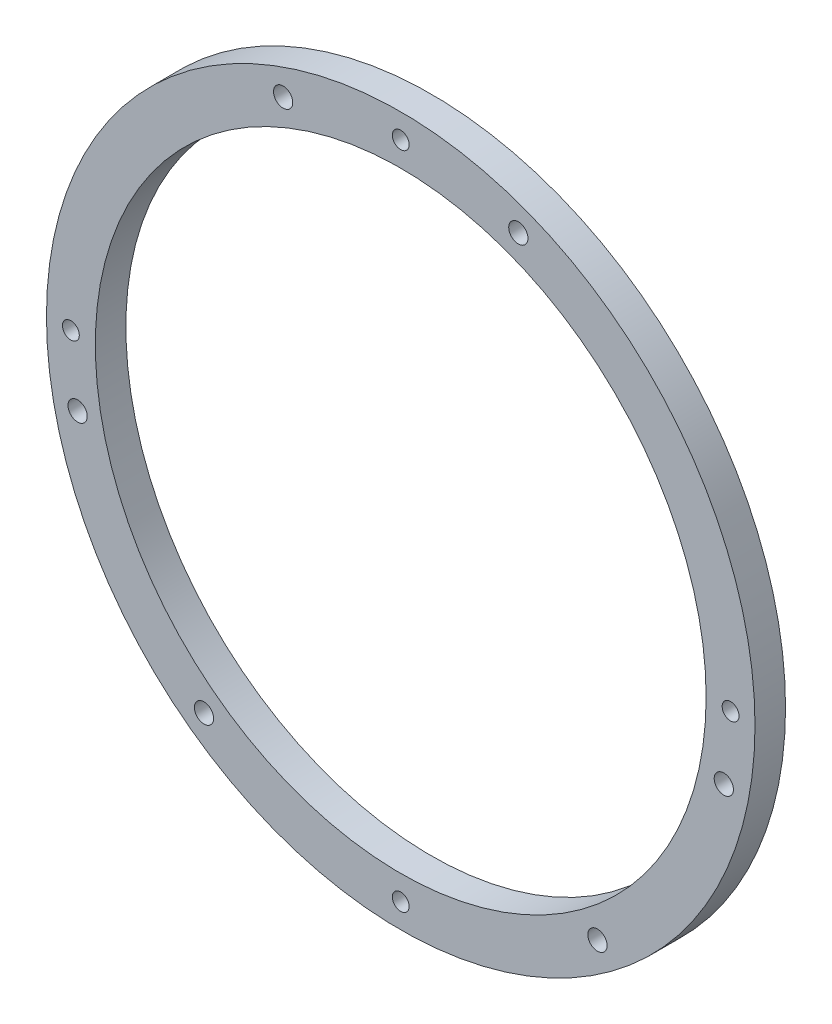
from build123d import *

# Parameters (mm, degrees)
SKETCH2_R           = 73.66
SKETCH2_R_2         = 63.5
SKETCH2_R_3         = 1.75
SKETCH2_R_4         = 2
BOSS_EXTRUDE1_DEPTH = 6.35


with BuildPart() as part:
    # Sketch2 → Boss-Extrude1 (new body)
    with BuildSketch(Plane.XY.offset(-69.215)):
        Circle(SKETCH2_R)
        Circle(SKETCH2_R_2, mode=Mode.SUBTRACT)
        with Locations((-68.58, 0)):
            Circle(SKETCH2_R_3, mode=Mode.SUBTRACT)
        with Locations((0, 68.58)):
            Circle(SKETCH2_R_3, mode=Mode.SUBTRACT)
        with Locations((68.58, 0)):
            Circle(SKETCH2_R_3, mode=Mode.SUBTRACT)
        with Locations((0, -68.58)):
            Circle(SKETCH2_R_3, mode=Mode.SUBTRACT)
        with Locations((-24.449968278, 64.073515989)):
            Circle(SKETCH2_R_4, mode=Mode.SUBTRACT)
        with Locations((24.449968278, 64.073515989)):
            Circle(SKETCH2_R_4, mode=Mode.SUBTRACT)
        with Locations((-67.176013668, -13.80578095)):
            Circle(SKETCH2_R_4, mode=Mode.SUBTRACT)
        with Locations((-40.902096909, -55.047569142)):
            Circle(SKETCH2_R_4, mode=Mode.SUBTRACT)
        with Locations((40.902096909, -55.047569142)):
            Circle(SKETCH2_R_4, mode=Mode.SUBTRACT)
        with Locations((67.176013668, -13.80578095)):
            Circle(SKETCH2_R_4, mode=Mode.SUBTRACT)
    extrude(amount=BOSS_EXTRUDE1_DEPTH)


solid = part.part
